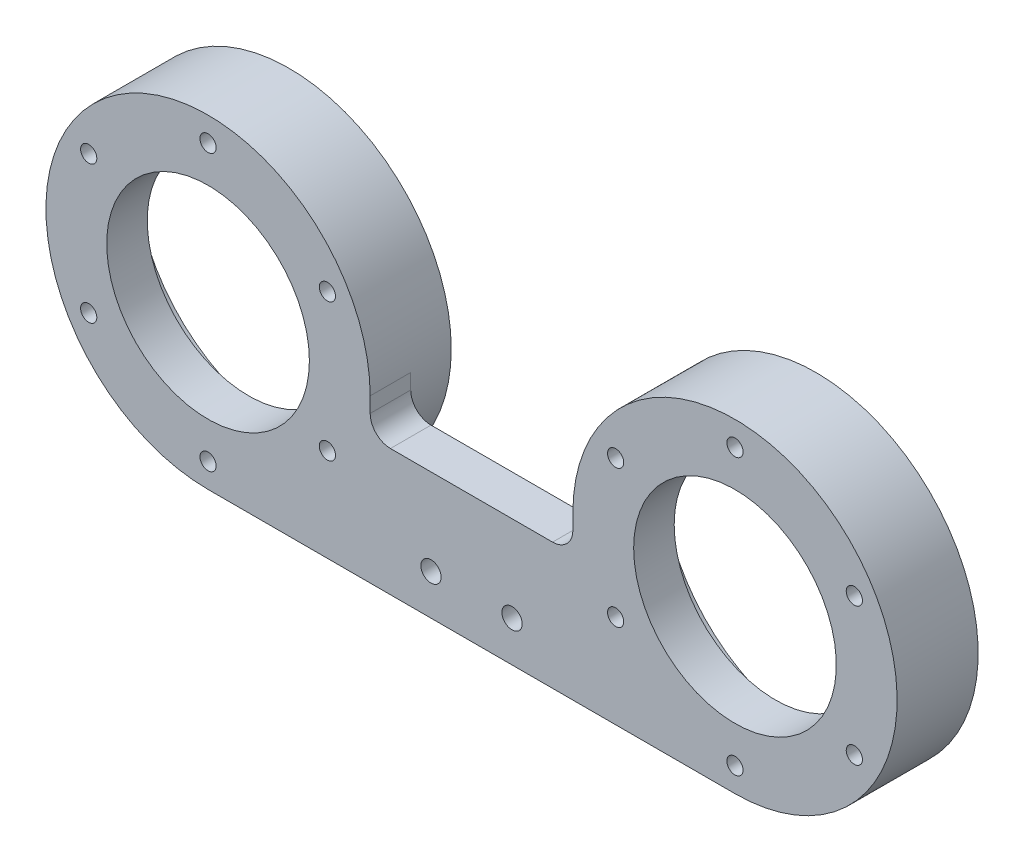
from build123d import *
from build123d.topology import SkipClean

# Parameters (mm, degrees)
SKETCH1_R           = 2
SKETCH1_R_2         = 2.5
BOSS_EXTRUDE1_DEPTH = 5
SKETCH2_R           = 3
CUT_EXTRUDE2_DEPTH  = 5
SKETCH6_R           = 40
SKETCH6_R_2         = 38
BOSS_EXTRUDE2_DEPTH = 10
CUT_EXTRUDE3_DEPTH  = 29
FILLET1_R           = 5


with BuildPart() as part:
    # Sketch1 → Boss-Extrude1 (new, symmetric)
    with SkipClean():  # the faces are left unmerged after this step: merging them gives an invalid solid
        with BuildSketch(Plane.XY):
            with BuildLine():
                Line((0, 40), (130, 40))
                ThreePointArc((130, 40), (170, 0), (130, -40))
                Line((130, -40), (0, -40))
                ThreePointArc((0, -40), (-40, 0), (0, 40))
            make_face()
            with Locations((0, 34)):
                Circle(SKETCH1_R, mode=Mode.SUBTRACT)
            with Locations((29.444863729, 17)):
                Circle(SKETCH1_R, mode=Mode.SUBTRACT)
            with Locations((29.444863729, -17)):
                Circle(SKETCH1_R, mode=Mode.SUBTRACT)
            with Locations((0, -34)):
                Circle(SKETCH1_R, mode=Mode.SUBTRACT)
            with Locations((-29.444863729, -17)):
                Circle(SKETCH1_R, mode=Mode.SUBTRACT)
            with Locations((-29.444863729, 17)):
                Circle(SKETCH1_R, mode=Mode.SUBTRACT)
            with Locations(Location((130, -34, 0), (0, 0, 180))):
                Circle(SKETCH1_R, mode=Mode.SUBTRACT)
            with Locations(Location((159.444863729, 17, 0), (0, 0, 180))):
                Circle(SKETCH1_R, mode=Mode.SUBTRACT)
            with Locations(Location((159.444863729, -17, 0), (0, 0, 180))):
                Circle(SKETCH1_R, mode=Mode.SUBTRACT)
            with Locations(Location((100.555136271, -17, 0), (0, 0, 180))):
                Circle(SKETCH1_R, mode=Mode.SUBTRACT)
            with Locations(Location((100.555136271, 17, 0), (0, 0, 180))):
                Circle(SKETCH1_R, mode=Mode.SUBTRACT)
            with Locations(Location((130, 34, 0), (0, 0, 180))):
                Circle(SKETCH1_R, mode=Mode.SUBTRACT)
            with Locations((55, 30)):
                Circle(SKETCH1_R_2, mode=Mode.SUBTRACT)
            with Locations(Location((75, 30, 0), (0, 0, 180))):
                Circle(SKETCH1_R_2, mode=Mode.SUBTRACT)
            with Locations((75, -30)):
                Circle(SKETCH1_R_2, mode=Mode.SUBTRACT)
            with Locations(Location((55, -30, 0), (0, 0, 180))):
                Circle(SKETCH1_R_2, mode=Mode.SUBTRACT)
            with BuildLine():
                ThreePointArc((25, 0), (0, 25), (-25, 0))
                ThreePointArc((-25, 0), (0, -25), (25, 0))
            make_face(mode=Mode.SUBTRACT)
            with BuildLine():
                ThreePointArc((155, 0), (130, -25), (105, 0))
                ThreePointArc((105, 0), (130, 25), (155, 0))
            make_face(mode=Mode.SUBTRACT)
        extrude(amount=BOSS_EXTRUDE1_DEPTH, both=True)
    add(part.part.scale(1), mode=Mode.REPLACE)  # the faces are merged on a copy

    # Sketch2 → Cut-Extrude2 (cut)
    with BuildSketch(Plane(origin=(0, 0, -5), x_dir=(-1, 0, 0), z_dir=(0, 0, -1))):
        with Locations((-130, 34)):
            Circle(SKETCH2_R)
        with Locations((-100.555136271, 17)):
            Circle(SKETCH2_R)
        with Locations((-100.555136271, -17)):
            Circle(SKETCH2_R)
        with Locations((-130, -34)):
            Circle(SKETCH2_R)
        with Locations((-159.444863729, -17)):
            Circle(SKETCH2_R)
        with Locations((-159.444863729, 17)):
            Circle(SKETCH2_R)
        with Locations(Location((29.444863729, 17, 0), (0, 0, 180))):
            Circle(SKETCH2_R)
        with Locations(Location((29.444863729, -17, 0), (0, 0, 180))):
            Circle(SKETCH2_R)
        with Locations(Location((0, -34, 0), (0, 0, 180))):
            Circle(SKETCH2_R)
        with Locations(Location((-29.444863729, -17, 0), (0, 0, 180))):
            Circle(SKETCH2_R)
        with Locations(Location((-29.444863729, 17, 0), (0, 0, 180))):
            Circle(SKETCH2_R)
        with Locations(Location((0, 34, 0), (0, 0, 180))):
            Circle(SKETCH2_R)
    extrude(amount=-CUT_EXTRUDE2_DEPTH, mode=Mode.SUBTRACT)

    # Sketch6 → Boss-Extrude2 (add)
    # profile 1 of 2: a face of its own
    with SkipClean():  # the faces are left unmerged after this step: merging them gives an invalid solid
        with BuildSketch(Plane.XY.offset(-5)):
            with Locations(Location((0, 0, 0), (0, 0, 90))):
                Circle(SKETCH6_R)
            Circle(SKETCH6_R_2, mode=Mode.SUBTRACT)
        # profile 2 of 2: a face of its own
        with BuildSketch(Plane.XY.offset(-5)):
            with Locations(Location((130, 0, 0), (0, 0, 180))):
                Circle(SKETCH6_R)
            with Locations((130, 0)):
                Circle(SKETCH6_R_2, mode=Mode.SUBTRACT)
        extrude(amount=-BOSS_EXTRUDE2_DEPTH)
    add(part.part.scale(1), mode=Mode.REPLACE)  # the faces are merged on a copy

    # Sketch7 → Cut-Extrude3 (cut)
    with SkipClean():  # the faces are left unmerged after this step: merging them gives an invalid solid
        with BuildSketch(Plane.XY.offset(5)):
            with BuildLine():
                Line((0, 52.799950915), (130, 52.799950915))
                Line((130, 52.799950915), (130, 40))
                ThreePointArc((130, 40), (101.715728753, 28.284271247), (90, 0))
                Line((90, 0), (90, -8.75))
                Line((90, -8.75), (40, -8.75))
                Line((40, -8.75), (40, 0))
                ThreePointArc((40, 0), (28.284271247, 28.284271247), (0, 40))
                Line((0, 40), (0, 52.799950915))
            make_face()
        extrude(amount=-CUT_EXTRUDE3_DEPTH, mode=Mode.SUBTRACT)

    # Fillet1
    fillet1_edges = [part.edges().sort_by_distance(p)[0] for p in [
        (90, -8.75, 0),
        (40, -8.75, 0),
    ]]
    fillet(fillet1_edges, radius=FILLET1_R)


solid = part.part
